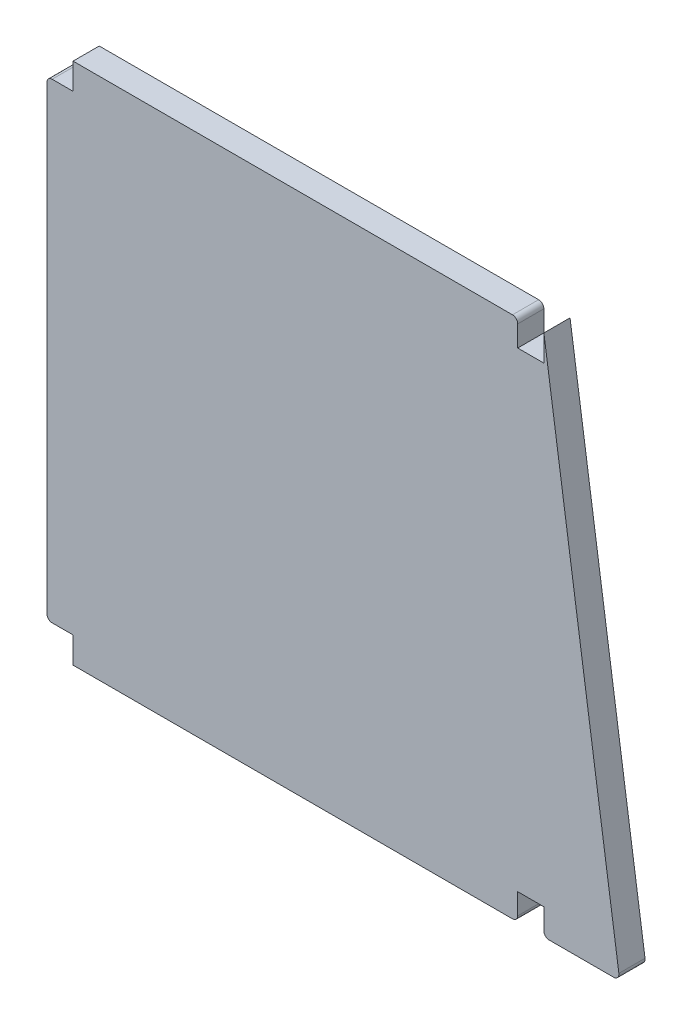
from build123d import *

# Parameters (mm, degrees)
BOSS_EXTRUDE1_DEPTH = 5
FILLET1_R           = 1


with BuildPart() as part:
    # Sketch1 → Boss-Extrude1 (new body)
    with BuildSketch(Plane.XY):
        Polygon((0, 95), (0, 100), (85, 100), (85, 95), (90, 95), (90, 100), (104.5, 0), (90, 0), (90, 5), (85, 5), (85, 0), (0, 0), (0, 5), (-5, 5), (-5, 95), align=None)
    extrude(amount=BOSS_EXTRUDE1_DEPTH)

    # Fillet1
    fillet1_edges = [part.edges().sort_by_distance(p)[0] for p in [
        (85, 100, 2.5),
        (104.5, 0, 2.5),
        (90, 0, 2.5),
        (85, 0, 2.5),
        (-5, 5, 2.5),
        (-5, 95, 2.5),
    ]]
    fillet(fillet1_edges, radius=FILLET1_R)


solid = part.part
